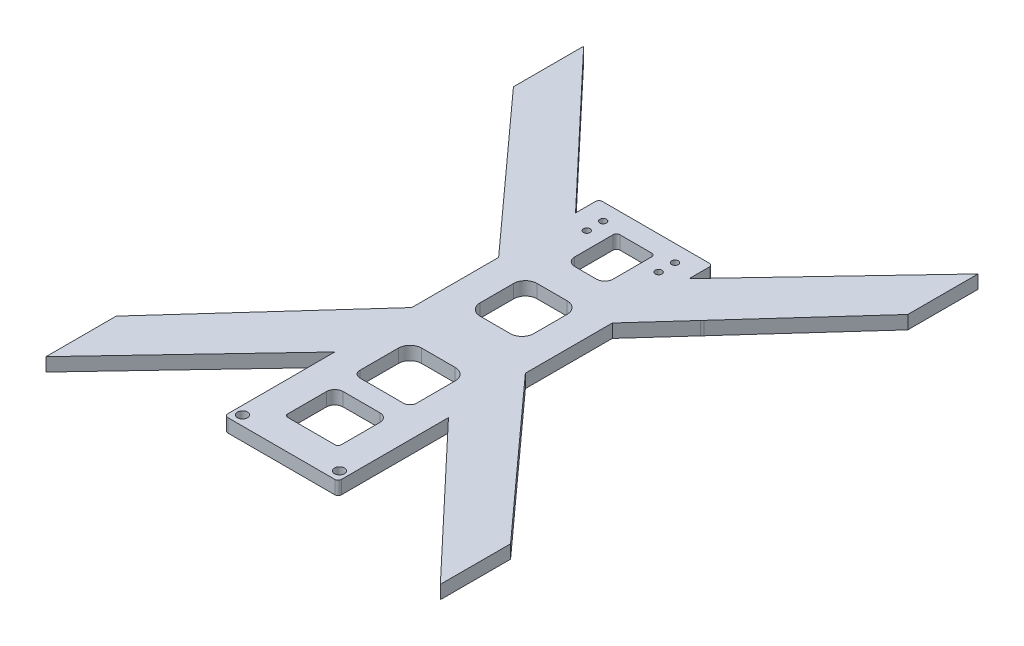
from build123d import *

# Parameters (mm, degrees)
FRAME_SKETCH_R           = 1.5
FRAME_SKETCH_R_2         = 1
FRAME_BOTTOM_PLATE_DEPTH = 4


with BuildPart() as part:
    # Frame Sketch → Frame Bottom Plate (new body)
    with BuildSketch(Plane(origin=(0, 0, 0), x_dir=(1, 0, 0), z_dir=(0, 1, 0))):
        with BuildLine():
            Line((22.298083729, 56.140393786), (-9.701916271, 56.140393786))
            ThreePointArc((-9.701916271, 56.140393786), (-10.409023052, 55.847500567), (-10.701916271, 55.140393786))
            Line((-10.701916271, 55.140393786), (-10.701916271, 49.140393786))
            Line((-10.701916271, 49.140393786), (-52.674742656, 93.542748615))
            Line((-52.674742656, 93.542748615), (-52.674742656, 72.542748615))
            Line((-52.674742656, 72.542748615), (-10.701916271, 26.140393786))
            Line((-10.701916271, 26.140393786), (-10.701916271, 0.140393786))
            Line((-10.701916271, 0.140393786), (-23.064124576, -13.52643844))
            add(Edge.make_bspline(
                [(-23.064124576, -13.52643844), (-23.273370365, -13.763675927), (-23.485967277, -13.998732361), (-23.701916271, -14.23153836)],
                knots=[0.98457333, 0.98457333, 0.98457333, 0.98457333, 1, 1, 1, 1], degree=3))
            Line((-23.701916271, -14.23153836), (-52.674742656, -46.261961044))
            Line((-52.674742656, -46.261961044), (-52.674742656, -67.261961044))
            Line((-52.674742656, -67.261961044), (-10.701916271, -22.859606214))
            Line((-10.701916271, -22.859606214), (-10.701916271, -54.859606214))
            ThreePointArc((-10.701916271, -54.859606214), (-10.409023052, -55.566712995), (-9.701916271, -55.859606214))
            Line((-9.701916271, -55.859606214), (22.298083729, -55.859606214))
            ThreePointArc((22.298083729, -55.859606214), (23.00519051, -55.566712995), (23.298083729, -54.859606214))
            Line((23.298083729, -54.859606214), (23.298083729, -22.859606214))
            Line((23.298083729, -22.859606214), (65.270910114, -67.261961044))
            Line((65.270910114, -67.261961044), (65.270910114, -46.261961044))
            Line((65.270910114, -46.261961044), (23.298083729, 0.140393786))
            Line((23.298083729, 0.140393786), (23.298083729, 26.140393786))
            Line((23.298083729, 26.140393786), (35.839011032, 40.004805804))
            add(Edge.make_bspline(
                [(36.298083729, 40.512325932), (36.143349049, 40.344312056), (35.990324697, 40.175130012), (35.839011032, 40.004805804)],
                knots=[0, 0, 0, 0, 0.011122864, 0.011122864, 0.011122864, 0.011122864], degree=3))
            Line((36.298083729, 40.512325932), (65.270910114, 72.542748615))
            Line((65.270910114, 72.542748615), (65.270910114, 93.542748615))
            Line((65.270910114, 93.542748615), (23.298083729, 49.140393786))
            Line((23.298083729, 49.140393786), (23.298083729, 55.140393786))
            ThreePointArc((23.298083729, 55.140393786), (23.00519051, 55.847500567), (22.298083729, 56.140393786))
        make_face()
        with Locations((-8.201916271, -52.959606214)):
            Circle(FRAME_SKETCH_R, mode=Mode.SUBTRACT)
        with Locations((20.798083729, -52.959606214)):
            Circle(FRAME_SKETCH_R, mode=Mode.SUBTRACT)
        with BuildLine():
            Line((13.438477515, -46.859606214), (-0.842310056, -46.859606214))
            ThreePointArc((-0.842310056, -46.859606214), (-1.45014344, -46.607833383), (-1.701916271, -46))
            Line((-1.701916271, -46), (-1.701916271, -34.359606214))
            ThreePointArc((-1.701916271, -34.359606214), (-0.969683224, -32.591839261), (0.798083729, -31.859606214))
            Line((0.798083729, -31.859606214), (11.798083729, -31.859606214))
            ThreePointArc((11.798083729, -31.859606214), (13.565850682, -32.591839261), (14.298083729, -34.359606214))
            Line((14.298083729, -34.359606214), (14.298083729, -46))
            ThreePointArc((14.298083729, -46), (14.046310898, -46.607833383), (13.438477515, -46.859606214))
        make_face(mode=Mode.SUBTRACT)
        with BuildLine():
            ThreePointArc((14.798083729, -23.859606214), (14.212297292, -25.273819777), (12.798083729, -25.859606214))
            Line((12.798083729, -25.859606214), (-0.201916271, -25.859606214))
            ThreePointArc((-0.201916271, -25.859606214), (-1.616129833, -25.273819777), (-2.201916271, -23.859606214))
            Line((-2.201916271, -23.859606214), (-2.201916271, -12.359606214))
            ThreePointArc((-2.201916271, -12.359606214), (-1.176790005, -9.88473248), (1.298083729, -8.859606214))
            Line((1.298083729, -8.859606214), (11.298083729, -8.859606214))
            ThreePointArc((11.298083729, -8.859606214), (13.772957463, -9.88473248), (14.798083729, -12.359606214))
            Line((14.798083729, -12.359606214), (14.798083729, -23.859606214))
        make_face(mode=Mode.SUBTRACT)
        with Locations((-4.451916271, 46.240393786)):
            Circle(FRAME_SKETCH_R_2, mode=Mode.SUBTRACT)
        with Locations((-4.451916271, 51.140393786)):
            Circle(FRAME_SKETCH_R_2, mode=Mode.SUBTRACT)
        with BuildLine():
            Line((10.798083729, 8.140393786), (1.798083729, 8.140393786))
            ThreePointArc((1.798083729, 8.140393786), (-0.676790005, 9.165520052), (-1.701916271, 11.640393786))
            Line((-1.701916271, 11.640393786), (-1.701916271, 21.640393786))
            ThreePointArc((-1.701916271, 21.640393786), (-0.676790005, 24.11526752), (1.798083729, 25.140393786))
            Line((1.798083729, 25.140393786), (10.798083729, 25.140393786))
            ThreePointArc((10.798083729, 25.140393786), (13.272957463, 24.11526752), (14.298083729, 21.640393786))
            Line((14.298083729, 21.640393786), (14.298083729, 11.640393786))
            ThreePointArc((14.298083729, 11.640393786), (13.272957463, 9.165520052), (10.798083729, 8.140393786))
        make_face(mode=Mode.SUBTRACT)
        with BuildLine():
            Line((9.548083729, 35.140393786), (3.048083729, 35.140393786))
            ThreePointArc((3.048083729, 35.140393786), (1.280316776, 35.872626833), (0.548083729, 37.640393786))
            Line((0.548083729, 37.640393786), (0.548083729, 49.140393786))
            ThreePointArc((0.548083729, 49.140393786), (0.840976948, 49.847500567), (1.548083729, 50.140393786))
            Line((1.548083729, 50.140393786), (11.048083729, 50.140393786))
            ThreePointArc((11.048083729, 50.140393786), (11.75519051, 49.847500567), (12.048083729, 49.140393786))
            Line((12.048083729, 49.140393786), (12.048083729, 37.640393786))
            ThreePointArc((12.048083729, 37.640393786), (11.315850682, 35.872626833), (9.548083729, 35.140393786))
        make_face(mode=Mode.SUBTRACT)
        with Locations((17.048083729, 46.240393786)):
            Circle(FRAME_SKETCH_R_2, mode=Mode.SUBTRACT)
        with Locations((17.048083729, 51.140393786)):
            Circle(FRAME_SKETCH_R_2, mode=Mode.SUBTRACT)
    extrude(amount=FRAME_BOTTOM_PLATE_DEPTH)


solid = part.part
